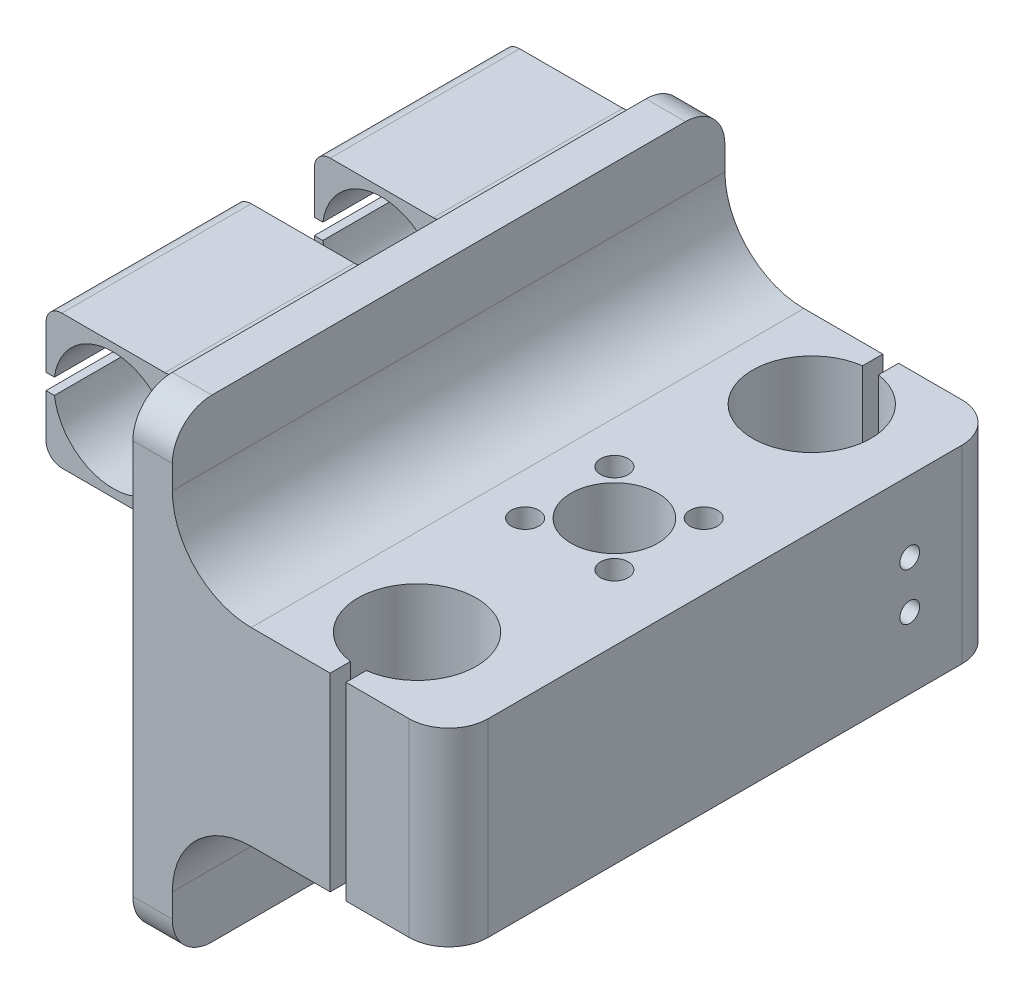
from build123d import *

# Parameters (mm, degrees)
SKETCH1_W               = 70
SKETCH1_H               = 60
BOSS_EXTRUDE3_DEPTH     = 5
FILLET2_R               = 5
SKETCH4_W               = 70
SKETCH4_H               = 24
BOSS_EXTRUDE5_DEPTH     = 35
FILLET4_R               = 5
CUT_EXTRUDE2_DEPTH      = 69.90984967
CUT_EXTRUDE2_DEPTH_BACK = 69.90984967
SKETCH5_R               = 7.5
SKETCH5_R_2             = 1.75
SKETCH5_R_3             = 5.5
SKETCH5_W               = 2
SKETCH5_H               = 4.51340439
SKETCH5_H_2             = 4.308458094
FILLET5_R               = 10
SKETCH6_W               = 24
SKETCH6_H               = 17
BOSS_EXTRUDE6_DEPTH     = 17
CUT_EXTRUDE3_DEPTH      = 94.837114918
CUT_EXTRUDE3_DEPTH_BACK = 94.837114918
SKETCH7_W               = 1.676391699
SKETCH7_H               = 2
FILLET6_R               = 2
SKETCH8_W               = 10
SKETCH8_H               = 5
BOSS_EXTRUDE7_DEPTH     = 10
CUT_EXTRUDE4_DEPTH      = 84.176944739
CUT_EXTRUDE4_DEPTH_BACK = 84.176944739
SKETCH9_W               = 7
SKETCH9_H               = 7
FILLET7_R               = 1
CUT_EXTRUDE5_DEPTH      = 76.623881926
CUT_EXTRUDE6_DEPTH      = 3
SKETCH11_R              = 1.25
CUT_EXTRUDE7_DEPTH      = 3


with BuildPart() as part:
    # Sketch1 → Boss-Extrude3 (new body)
    with BuildSketch(Plane(origin=(0, 0, 0), x_dir=(0, 0, -1), z_dir=(1, 0, 0))):
        with Locations((-2.209775349, 25.762031313)):
            Rectangle(SKETCH1_W, SKETCH1_H)
    extrude(amount=BOSS_EXTRUDE3_DEPTH)

    # Fillet2
    fillet2_edges = [part.edges().sort_by_distance(p)[0] for p in [
        (2.5, 55.762031313, 37.209775349),
        (2.5, 55.762031313, -32.790224651),
        (2.5, -4.237968687, -32.790224651),
        (2.5, -4.237968687, 37.209775349),
    ]]
    fillet(fillet2_edges, radius=FILLET2_R)

    # Sketch4 → Boss-Extrude5 (add)
    with BuildSketch(Plane(origin=(5, 0, 0), x_dir=(0, 0, -1), z_dir=(1, 0, 0))):
        with Locations((-2.209775349, 25.762031313)):
            Rectangle(SKETCH4_W, SKETCH4_H)
    extrude(amount=BOSS_EXTRUDE5_DEPTH)

    # Fillet4
    fillet4_edges = [part.edges().sort_by_distance(p)[0] for p in [
        (40, 25.762031313, 37.209775349),
        (40, 25.762031313, -32.790224651),
    ]]
    fillet(fillet4_edges, radius=FILLET4_R)

    # Sketch5 → Cut-Extrude2 (cut, two sides: drawn at the far end of the back side and taken through both)
    with BuildSketch(Plane(origin=(0, 13.762031313, 0), x_dir=(-1, 0, 0), z_dir=(0, -1, 0)).offset(-CUT_EXTRUDE2_DEPTH_BACK)):
        with Locations((-26, -27.209775349)):
            Circle(SKETCH5_R)
        with Locations((-26, 22.790224651)):
            Circle(SKETCH5_R)
        with Locations(Location((-31.656854249, -7.866629598, 0), (0, 0, 90))):
            Circle(SKETCH5_R_2)
        with Locations(Location((-31.656854249, 3.447078901, 0), (0, 0, 90))):
            Circle(SKETCH5_R_2)
        with Locations(Location((-20.343145751, 3.447078901, 0), (0, 0, 90))):
            Circle(SKETCH5_R_2)
        with Locations(Location((-20.343145751, -7.866629598, 0), (0, 0, 90))):
            Circle(SKETCH5_R_2)
        with Locations(Location((-26, -2.209775349, 0), (0, 0, 90))):
            Circle(SKETCH5_R_3)
        with BuildLine():
            Line((-27, 30.223259025), (-27, 27.895040572))
            Line((-27, 27.895040572), (-25, 27.895040572))
            Line((-25, 27.895040572), (-25, 30.223259025))
            ThreePointArc((-25, 30.223259025), (-26, 30.290224651), (-27, 30.223259025))
        make_face()
        with BuildLine():
            Line((-25, 27.895040572), (-27, 27.895040572))
            Line((-27, 27.895040572), (-27, 30.223259025))
            ThreePointArc((-27, 30.223259025), (-30.937104415, 17.144429756), (-18.5, 22.790224651))
            ThreePointArc((-18.5, 22.790224651), (-20.354205105, 27.727329066), (-25, 30.223259025))
            Line((-25, 30.223259025), (-25, 27.895040572))
        make_face()
        with BuildLine():
            Line((-27, 32.790224651), (-27, 30.223259025))
            ThreePointArc((-27, 30.223259025), (-26, 30.290224651), (-25, 30.223259025))
            Line((-25, 30.223259025), (-25, 32.790224651))
            Line((-25, 32.790224651), (-27, 32.790224651))
        make_face()
        with Locations((-26, 35.046926846)):
            Rectangle(SKETCH5_W, SKETCH5_H)
        with BuildLine():
            ThreePointArc((-18.5, -27.209775349), (-30.937104415, -21.563980453), (-27, -34.642809722))
            Line((-27, -34.642809722), (-27, -32.579541542))
            Line((-27, -32.579541542), (-25, -32.579541542))
            Line((-25, -32.579541542), (-25, -34.642809722))
            ThreePointArc((-25, -34.642809722), (-20.354205105, -32.146879763), (-18.5, -27.209775349))
        make_face()
        with BuildLine():
            Line((-27, -32.579541542), (-27, -34.642809722))
            ThreePointArc((-27, -34.642809722), (-26, -34.709775349), (-25, -34.642809722))
            Line((-25, -34.642809722), (-25, -32.579541542))
            Line((-25, -32.579541542), (-27, -32.579541542))
        make_face()
        with BuildLine():
            Line((-27, -34.642809722), (-27, -37.209775349))
            Line((-27, -37.209775349), (-25, -37.209775349))
            Line((-25, -37.209775349), (-25, -34.642809722))
            ThreePointArc((-25, -34.642809722), (-26, -34.709775349), (-27, -34.642809722))
        make_face()
        with Locations((-26, -39.364004396)):
            Rectangle(SKETCH5_W, SKETCH5_H_2)
    extrude(amount=CUT_EXTRUDE2_DEPTH + CUT_EXTRUDE2_DEPTH_BACK, mode=Mode.SUBTRACT)

    # Fillet5
    fillet5_edges = [part.edges().sort_by_distance(p)[0] for p in [
        (5, 13.762031313, 2.209775349),
        (5, 37.762031313, 2.209775349),
    ]]
    fillet(fillet5_edges, radius=FILLET5_R)

    # Sketch6 → Boss-Extrude6 (add)
    with BuildSketch(Plane.ZY):
        with Locations((2.209775349, 5.762031313)):
            Rectangle(SKETCH6_W, SKETCH6_H)
        with Locations((-14.790224651, 45.762031313)):
            Rectangle(SKETCH6_W, SKETCH6_H)
        with Locations((19.209775349, 45.762031313)):
            Rectangle(SKETCH6_W, SKETCH6_H)
    extrude(amount=BOSS_EXTRUDE6_DEPTH)

    # Sketch7 → Cut-Extrude3 (cut, two sides: drawn at the far end of the back side and taken through both)
    with BuildSketch(Plane(origin=(0, 0, -26.790224651), x_dir=(-1, 0, 0), z_dir=(0, 0, -1)).offset(-CUT_EXTRUDE3_DEPTH_BACK)):
        with BuildLine():
            Line((14.708330611, 44.762031313), (14.708330611, 46.762031313))
            Line((14.708330611, 46.762031313), (15.933034374, 46.762031313))
            ThreePointArc((15.933034374, 46.762031313), (1, 45.762031313), (15.933034374, 44.762031313))
            Line((15.933034374, 44.762031313), (14.708330611, 44.762031313))
        make_face()
        with BuildLine():
            Line((15.933034374, 46.762031313), (14.708330611, 46.762031313))
            Line((14.708330611, 46.762031313), (14.708330611, 44.762031313))
            Line((14.708330611, 44.762031313), (15.933034374, 44.762031313))
            ThreePointArc((15.933034374, 44.762031313), (15.983239867, 45.260911468), (16, 45.762031313))
            ThreePointArc((16, 45.762031313), (15.983239867, 46.263151157), (15.933034374, 46.762031313))
        make_face()
        with BuildLine():
            Line((17, 46.762031313), (15.933034374, 46.762031313))
            ThreePointArc((15.933034374, 46.762031313), (15.983239867, 46.263151157), (16, 45.762031313))
            ThreePointArc((16, 45.762031313), (15.983239867, 45.260911468), (15.933034374, 44.762031313))
            Line((15.933034374, 44.762031313), (17, 44.762031313))
            Line((17, 44.762031313), (17, 46.762031313))
        make_face()
        with Locations((17.838195849, 45.762031313)):
            Rectangle(SKETCH7_W, SKETCH7_H)
        with BuildLine():
            Line((14.795029653, 4.762031313), (14.795029653, 6.762031313))
            Line((14.795029653, 6.762031313), (15.933034374, 6.762031313))
            ThreePointArc((15.933034374, 6.762031313), (1, 5.762031313), (15.933034374, 4.762031313))
            Line((15.933034374, 4.762031313), (14.795029653, 4.762031313))
        make_face()
        with BuildLine():
            Line((15.933034374, 6.762031313), (14.795029653, 6.762031313))
            Line((14.795029653, 6.762031313), (14.795029653, 4.762031313))
            Line((14.795029653, 4.762031313), (15.933034374, 4.762031313))
            ThreePointArc((15.933034374, 4.762031313), (15.983239867, 5.260911468), (16, 5.762031313))
            ThreePointArc((16, 5.762031313), (15.983239867, 6.263151157), (15.933034374, 6.762031313))
        make_face()
        with BuildLine():
            Line((19.308722913, 6.762031313), (15.933034374, 6.762031313))
            ThreePointArc((15.933034374, 6.762031313), (15.983239867, 6.263151157), (16, 5.762031313))
            ThreePointArc((16, 5.762031313), (15.983239867, 5.260911468), (15.933034374, 4.762031313))
            Line((15.933034374, 4.762031313), (19.308722913, 4.762031313))
            Line((19.308722913, 4.762031313), (19.308722913, 6.762031313))
        make_face()
    extrude(amount=CUT_EXTRUDE3_DEPTH + CUT_EXTRUDE3_DEPTH_BACK, mode=Mode.SUBTRACT)

    # Fillet6
    # the kernel refuses this fillet: 2 mm, written as the material it adds along each edge
    with BuildSketch(Plane(origin=(0, 37.262031313, -2.790224651), x_dir=(0, -1, 0), z_dir=(0, 0, -1)), Plane(origin=(0, 14.262031313, -9.790224651), x_dir=(0, 1, 0), z_dir=(0, 0, 1)), Plane(origin=(0, 37.262031313, 31.209775349), x_dir=(0, -1, 0), z_dir=(0, 0, -1))) as fillet6_piece_1:
        with BuildLine():
            CenterArc((FILLET6_R, FILLET6_R), FILLET6_R, 180, 90)
            Line((0, FILLET6_R), (0, 0))
            Line((0, 0), (FILLET6_R, 0))
        make_face()
    extrude(amount=24)
    with BuildSketch(Plane(origin=(0, 54.262031313, -26.790224651), x_dir=(0, 1, 0), z_dir=(0, 0, 1)), Plane(origin=(0, -2.737968687, 14.209775349), x_dir=(0, -1, 0), z_dir=(0, 0, -1)), Plane(origin=(0, 54.262031313, 7.209775349), x_dir=(0, 1, 0), z_dir=(0, 0, 1))) as fillet6_piece_2:
        with BuildLine():
            CenterArc((2, 1.936491673), FILLET6_R, 180, 75.522487814)
            Line((0, 1.936491673), (0, 0))
            Line((0, 0), (1.5, 0))
        make_face()
    extrude(amount=24)
    # the kernel refuses this fillet: 2 mm, written as the material it takes off along each edge
    with BuildSketch(Plane(origin=(-17, 37.262031313, 2.209775349), x_dir=(0, 1, 0), z_dir=(0, 0, -1)), Plane(origin=(-17, 54.262031313, -31.790224651), x_dir=(0, -1, 0), z_dir=(0, 0, 1)), Plane(origin=(-17, -2.737968687, 19.209775349), x_dir=(0, 1, 0), z_dir=(0, 0, -1)), Plane(origin=(-17, 14.262031313, -14.790224651), x_dir=(0, -1, 0), z_dir=(0, 0, 1)), Plane(origin=(-17, 37.262031313, 36.209775349), x_dir=(0, 1, 0), z_dir=(0, 0, -1)), Plane(origin=(-17, 54.262031313, 2.209775349), x_dir=(0, -1, 0), z_dir=(0, 0, 1))) as fillet6_2_piece_1:
        with BuildLine():
            CenterArc((FILLET6_R, FILLET6_R), FILLET6_R, 180, 90)
            Line((0, FILLET6_R), (0, 0))
            Line((0, 0), (FILLET6_R, 0))
        make_face()
    extrude(amount=34, mode=Mode.SUBTRACT)

    # Sketch8 → Boss-Extrude7 (add)
    with BuildSketch(Plane(origin=(0, 14.262031313, 0), x_dir=(1, 0, 0), z_dir=(0, 1, 0))):
        with Locations((-8.5, 7.290224651)):
            Rectangle(SKETCH8_W, SKETCH8_H)
        with Locations((-8.5, -11.709775349)):
            Rectangle(SKETCH8_W, SKETCH8_H)
    extrude(amount=BOSS_EXTRUDE7_DEPTH)

    # Sketch9 → Cut-Extrude4 (cut, two sides: drawn at the far end of the back side and taken through both)
    with BuildSketch(Plane(origin=(0, 0, -9.790224651), x_dir=(-1, 0, 0), z_dir=(0, 0, -1)).offset(-CUT_EXTRUDE4_DEPTH_BACK)):
        with Locations((8.5, 19.262031313)):
            Rectangle(SKETCH9_W, SKETCH9_H)
    extrude(amount=CUT_EXTRUDE4_DEPTH + CUT_EXTRUDE4_DEPTH_BACK, mode=Mode.SUBTRACT)

    # Fillet7
    fillet7_edges = [part.edges().sort_by_distance(p)[0] for p in [
        (-3.5, 24.262031313, -7.290224651),
        (-13.5, 24.262031313, -7.290224651),
        (-3.5, 24.262031313, 11.709775349),
        (-13.5, 24.262031313, 11.709775349),
    ]]
    fillet(fillet7_edges, radius=FILLET7_R)

    # Sketch10 → Cut-Extrude5 (cut, through all)
    with BuildSketch(Plane(origin=(5, 0, 0), x_dir=(0, 0, -1), z_dir=(1, 0, 0))):
        with BuildLine():
            Line((7.640224651, 10.762031313), (-12.059775349, 10.762031313))
            Line((-12.059775349, 10.762031313), (-12.059775349, 3.762031313))
            Line((-12.059775349, 3.762031313), (-8.209775349, 3.762031313))
            ThreePointArc((-8.209775349, 3.762031313), (-7.059775349, 4.912031313), (-5.909775349, 3.762031313))
            Line((-5.909775349, 3.762031313), (1.290224651, 3.762031313))
            ThreePointArc((1.290224651, 3.762031313), (2.440224651, 4.912031313), (3.590224651, 3.762031313))
            Line((3.590224651, 3.762031313), (7.640224651, 3.762031313))
            Line((7.640224651, 3.762031313), (7.640224651, 10.762031313))
        make_face()
        with BuildLine():
            Line((-8.209775349, 3.762031313), (-12.059775349, 3.762031313))
            Line((-12.059775349, 3.762031313), (-12.059775349, -4.237968687))
            Line((-12.059775349, -4.237968687), (7.640224651, -4.237968687))
            Line((7.640224651, -4.237968687), (7.640224651, 3.762031313))
            Line((7.640224651, 3.762031313), (3.590224651, 3.762031313))
            ThreePointArc((3.590224651, 3.762031313), (2.440224651, 2.612031313), (1.290224651, 3.762031313))
            Line((1.290224651, 3.762031313), (-5.909775349, 3.762031313))
            ThreePointArc((-5.909775349, 3.762031313), (-7.059775349, 2.612031313), (-8.209775349, 3.762031313))
        make_face()
        with BuildLine():
            Line((-5.909775349, 3.762031313), (-8.209775349, 3.762031313))
            ThreePointArc((-8.209775349, 3.762031313), (-7.059775349, 2.612031313), (-5.909775349, 3.762031313))
        make_face()
        with BuildLine():
            ThreePointArc((-5.909775349, 3.762031313), (-7.059775349, 4.912031313), (-8.209775349, 3.762031313))
            Line((-8.209775349, 3.762031313), (-5.909775349, 3.762031313))
        make_face()
        with BuildLine():
            Line((1.290224651, 3.762031313), (3.590224651, 3.762031313))
            ThreePointArc((3.590224651, 3.762031313), (2.440224651, 4.912031313), (1.290224651, 3.762031313))
        make_face()
        with BuildLine():
            ThreePointArc((1.290224651, 3.762031313), (2.440224651, 2.612031313), (3.590224651, 3.762031313))
            Line((3.590224651, 3.762031313), (1.290224651, 3.762031313))
        make_face()
    extrude(amount=CUT_EXTRUDE5_DEPTH, mode=Mode.SUBTRACT)

    # Sketch10<3> → Cut-Extrude6 (cut)
    with BuildSketch(Plane(origin=(5, 0, 0), x_dir=(0, 0, -1), z_dir=(1, 0, 0))):
        with BuildLine():
            Line((-5.909775349, 3.762031313), (-8.209775349, 3.762031313))
            ThreePointArc((-8.209775349, 3.762031313), (-7.059775349, 2.612031313), (-5.909775349, 3.762031313))
        make_face()
        with BuildLine():
            ThreePointArc((-5.909775349, 3.762031313), (-7.059775349, 4.912031313), (-8.209775349, 3.762031313))
            Line((-8.209775349, 3.762031313), (-5.909775349, 3.762031313))
        make_face()
        with BuildLine():
            Line((1.290224651, 3.762031313), (3.590224651, 3.762031313))
            ThreePointArc((3.590224651, 3.762031313), (2.440224651, 4.912031313), (1.290224651, 3.762031313))
        make_face()
        with BuildLine():
            ThreePointArc((1.290224651, 3.762031313), (2.440224651, 2.612031313), (3.590224651, 3.762031313))
            Line((3.590224651, 3.762031313), (1.290224651, 3.762031313))
        make_face()
    extrude(amount=-CUT_EXTRUDE6_DEPTH, mode=Mode.SUBTRACT)

    # Sketch11 → Cut-Extrude7 (cut)
    with BuildSketch(Plane(origin=(40, 0, 0), x_dir=(0, 0, -1), z_dir=(1, 0, 0))):
        with Locations((21.199998978, 28.762031313)):
            Circle(SKETCH11_R)
        with Locations((21.199998978, 22.762031313)):
            Circle(SKETCH11_R)
    extrude(amount=-CUT_EXTRUDE7_DEPTH, mode=Mode.SUBTRACT)


solid = part.part
